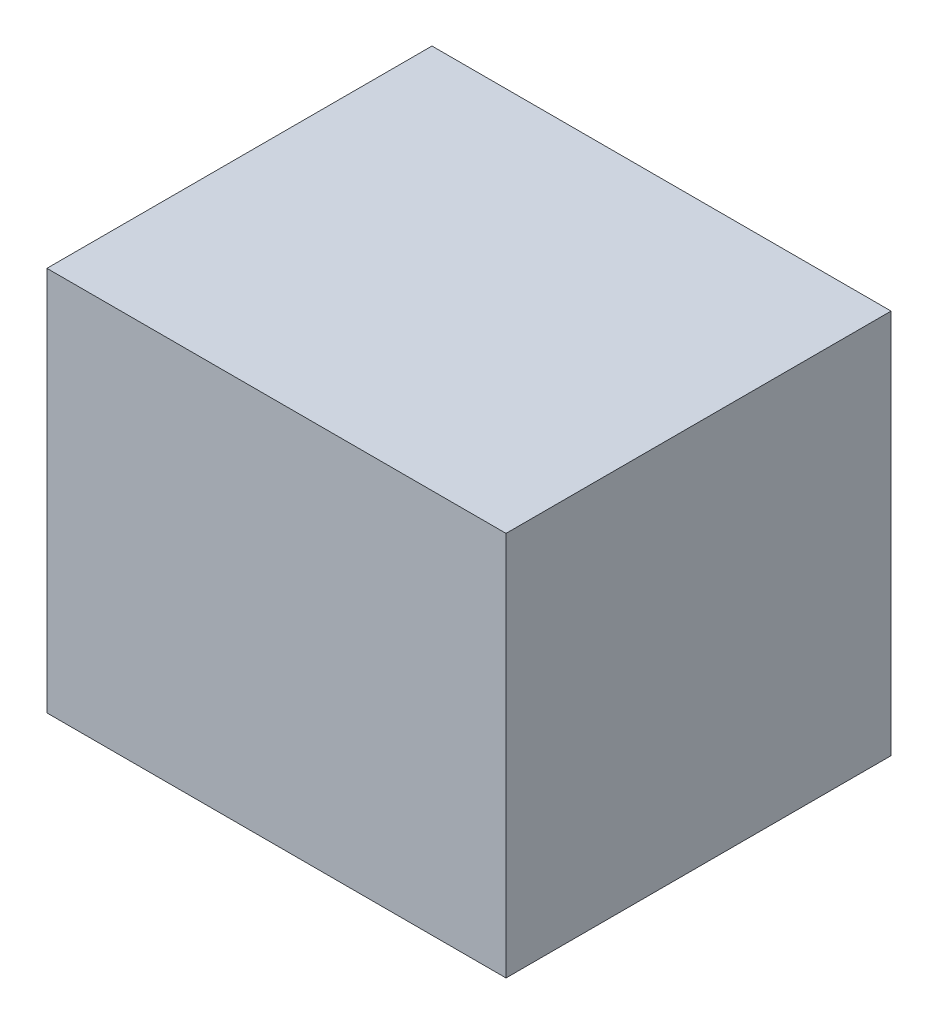
from build123d import *

# Parameters (mm, degrees)
SKIZZE1_W                       = 77.5
SKIZZE1_H                       = 65
AUFSATZ_LINEAR_AUSTRAGEN1_DEPTH = 65


with BuildPart() as part:
    # Skizze1 → Aufsatz-Linear austragen1 (new body)
    with BuildSketch(Plane.XY):
        Rectangle(SKIZZE1_W, SKIZZE1_H)
    extrude(amount=AUFSATZ_LINEAR_AUSTRAGEN1_DEPTH)


solid = part.part
